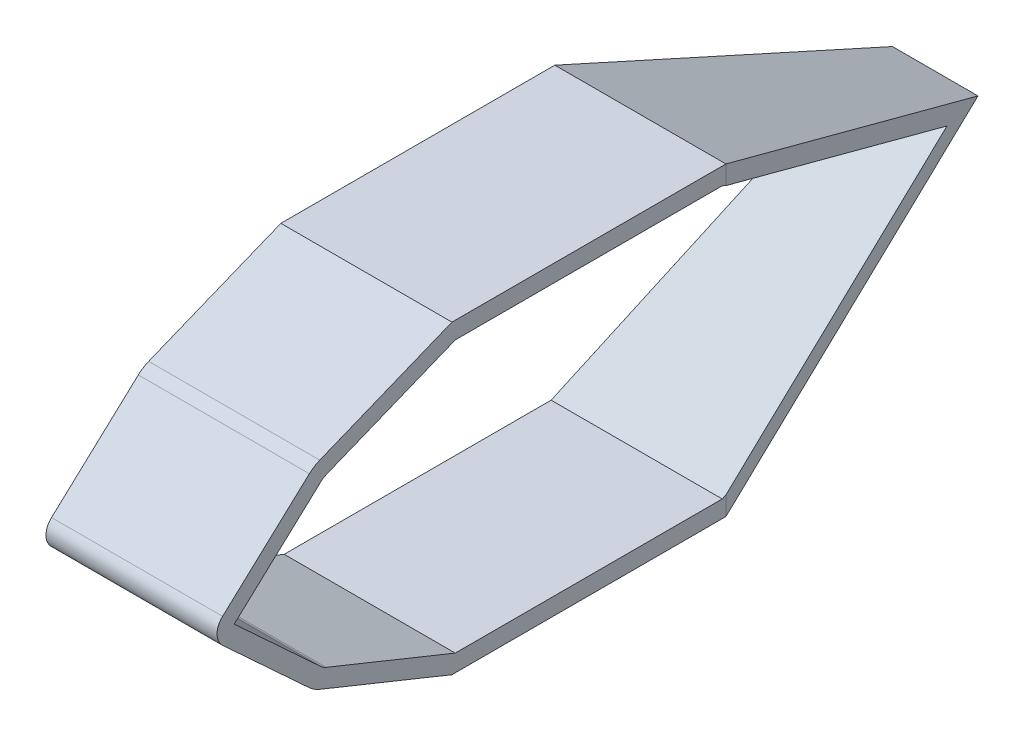
from build123d import *

# Parameters (mm, degrees)
BOSS_EXTRUDE1_DEPTH = 50
SHELL1_DEPTH        = 50
CUT_EXTRUDE2_DEPTH  = 173.364622498


# Read off the part's stored shape, not the designer's step: Shell1
with BuildPart() as part:
    # Sketch1 → Boss-Extrude1 (new body)
    with BuildSketch(Plane.YZ):
        with BuildLine():
            Line((-44.627499653, -40.034766679), (-44.627499653, 40.034766679))
            Line((-44.627499653, 40.034766679), (-29.010308673, 78.667639283))
            ThreePointArc((-29.010308673, 78.667639283), (-28.186204205, 80.272180413), (-27.087258828, 81.702571783))
            Line((-27.087258828, 81.702571783), (-3.674040134, 107.06723584))
            ThreePointArc((-3.674040134, 107.06723584), (0, 108.675860147), (3.674040134, 107.06723584))
            Line((3.674040134, 107.06723584), (27.087258828, 81.702571783))
            ThreePointArc((27.087258828, 81.702571783), (28.186204205, 80.272180413), (29.010308673, 78.667639283))
            Line((29.010308673, 78.667639283), (44.627499653, 40.034766679))
            Line((44.627499653, 40.034766679), (44.627499653, -40.034766679))
            Line((44.627499653, -40.034766679), (0, -138.719530665))
            Line((0, -138.719530665), (-44.627499653, -40.034766679))
        make_face()
    extrude(amount=BOSS_EXTRUDE1_DEPTH)

    # Shell1 outline → Shell1 (cut)
    with BuildSketch(Plane.YZ):
        with BuildLine():
            Line((-24.374743616, 76.79372984), (-39.627499653, 39.062374592))
            Line((-39.627499653, 39.062374592), (-39.627499653, -38.956762217))
            Line((-39.627499653, -38.956762217), (0, -126.585029116))
            Line((0, -126.585029116), (39.627499653, -38.956762217))
            Line((39.627499653, -38.956762217), (39.627499653, 39.062374592))
            Line((39.627499653, 39.062374592), (24.374743616, 76.79372984))
            ThreePointArc((24.374743616, 76.79372984), (23.962691382, 77.596000405), (23.413218693, 78.31119609))
            Line((23.413218693, 78.31119609), (0, 103.675860147))
            Line((0, 103.675860147), (-23.413218693, 78.31119609))
            ThreePointArc((-23.413218693, 78.31119609), (-23.962691382, 77.596000405), (-24.374743616, 76.79372984))
        make_face()
    extrude(amount=SHELL1_DEPTH, mode=Mode.SUBTRACT)

    # Sketch3 → Cut-Extrude2 (cut, through all)
    with BuildSketch(Plane(origin=(0, 44.627499653, 0), x_dir=(-1, 0, 0), z_dir=(0, 1, 0))):
        Polygon((-50, -40.034766679), (-25, -138.719530665), (-50, -138.719530665), align=None)
    extrude(amount=-CUT_EXTRUDE2_DEPTH, mode=Mode.SUBTRACT)


solid = part.part
